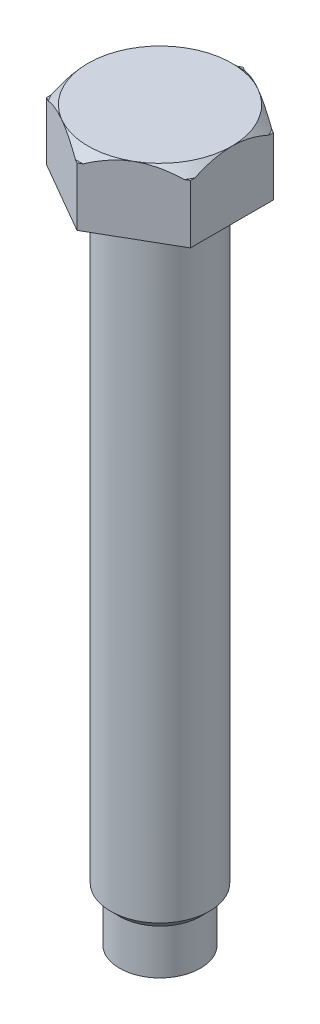
from build123d import *

# Parameters (mm, degrees)
SKETCH1_R      = 5.5
EXTRUDE1_DEPTH = 73
EXTRUDE2_DEPTH = 8
SKETCH3_R      = 14.116748978
SKETCH3_R_2    = 7
EXTRUDE3_DEPTH = 0.5
SKETCH4_R      = 19.693652211
SKETCH4_R_2    = 4.5
EXTRUDE4_DEPTH = 5
CHAMFER1_SIZE  = 1
SKETCH5_R      = 25.58893004
SKETCH5_R_2    = 8
EXTRUDE5_DEPTH = 1
CHAMFER2_SIZE  = 1


# Some blends are built 0.0001 mm under size
with BuildPart() as part:
    # Sketch1 → Extrude1 (new body)
    with BuildSketch(Plane(origin=(0, 0, 0), x_dir=(1, 0, 0), z_dir=(0, 1, 0))):
        with Locations(Location((0, 0, 0), (0, 0, 270))):
            Circle(SKETCH1_R)
    extrude(amount=EXTRUDE1_DEPTH)

    # Sketch2 → Extrude2 (add)
    with BuildSketch(Plane(origin=(0, 73, 0), x_dir=(1, 0, 0), z_dir=(0, 1, 0))):
        Polygon((8, -4.618802154), (8, 4.618802154), (0, 9.237604307), (-8, 4.618802154), (-8, -4.618802154), (0, -9.237604307), align=None)
    extrude(amount=EXTRUDE2_DEPTH)

    # Sketch3 → Extrude3 (cut)
    with BuildSketch(Plane.XZ.offset(-73)):
        Circle(SKETCH3_R)
        with Locations(Location((0, 0, 0), (0, 0, 270))):
            Circle(SKETCH3_R_2, mode=Mode.SUBTRACT)
    extrude(amount=-EXTRUDE3_DEPTH, mode=Mode.SUBTRACT)

    # Sketch4 → Extrude4 (cut)
    with BuildSketch(Plane.XZ):
        Circle(SKETCH4_R)
        with Locations(Location((0, 0, 0), (0, 0, 270))):
            Circle(SKETCH4_R_2, mode=Mode.SUBTRACT)
    extrude(amount=-EXTRUDE4_DEPTH, mode=Mode.SUBTRACT)

    # Chamfer1
    chamfer1_edges = [part.edges().sort_by_distance(p)[0] for p in [
        (0, 5, -5.5),
    ]]
    chamfer(chamfer1_edges, length=CHAMFER1_SIZE - 0.0001)  # a hair under: the kernel refuses the full size

    # Sketch5 → Extrude5 (cut)
    with BuildSketch(Plane(origin=(0, 81, 0), x_dir=(1, 0, 0), z_dir=(0, 1, 0))):
        Circle(SKETCH5_R)
        with Locations(Location((0, 0, 0), (0, 0, 270))):
            Circle(SKETCH5_R_2, mode=Mode.SUBTRACT)
    extrude(amount=-EXTRUDE5_DEPTH, mode=Mode.SUBTRACT)

    # Chamfer2
    # the kernel refuses this chamfer: 1 mm, written as the material it adds along each edge
    with BuildSketch(Plane(origin=(0, 80, 0), x_dir=(0.5000000000000043, 0, -0.8660254037844362), z_dir=(0.8660254037844362, 0, 0.5000000000000043))) as chamfer2_piece_1_section:
        Polygon((8, CHAMFER2_SIZE), (8 + CHAMFER2_SIZE, 0), (8, 0), align=None)
    chamfer2_piece_1 = revolve(axis=Axis((0, 80, 0), (0, 1, 0)), revolution_arc=60, mode=Mode.PRIVATE)
    chamfer2_piece_1 = split(chamfer2_piece_1, bisect_by=Plane(origin=(-0.488712857, 80.376891688, -8.955445807), z_dir=(0.49999999999999606, 0, 0.8660254037844412)), keep=Keep.TOP, mode=Mode.PRIVATE)
    chamfer2_piece_1 = split(chamfer2_piece_1, bisect_by=Plane(origin=(0.488712857, 80.376891688, -8.955445807), z_dir=(-0.500000000000004, 0, 0.8660254037844364)), keep=Keep.TOP, mode=Mode.PRIVATE)
    add(chamfer2_piece_1)
    with BuildSketch(Plane(origin=(0, 80, 0), x_dir=(-0.4999999999999957, 0, -0.8660254037844412), z_dir=(0.8660254037844412, 0, -0.4999999999999957))) as chamfer2_piece_2_section:
        Polygon((8, CHAMFER2_SIZE), (8 + CHAMFER2_SIZE, 0), (8, 0), align=None)
    chamfer2_piece_2 = revolve(axis=Axis((0, 80, 0), (0, 1, 0)), revolution_arc=60, mode=Mode.PRIVATE)
    chamfer2_piece_2 = split(chamfer2_piece_2, bisect_by=Plane(origin=(-8, 80.376891688, -4.054485154), z_dir=(1, 0, 0)), keep=Keep.TOP, mode=Mode.PRIVATE)
    chamfer2_piece_2 = split(chamfer2_piece_2, bisect_by=Plane(origin=(-7.511287143, 80.376891688, -4.900960653), z_dir=(0.49999999999999606, 0, 0.8660254037844412)), keep=Keep.TOP, mode=Mode.PRIVATE)
    add(chamfer2_piece_2)
    with BuildSketch(Plane(origin=(0, 80, 0), x_dir=(-1, 0, 0), z_dir=(0, 0, -1))) as chamfer2_piece_3_section:
        Polygon((8, CHAMFER2_SIZE), (8 + CHAMFER2_SIZE, 0), (8, 0), align=None)
    chamfer2_piece_3 = revolve(axis=Axis((0, 80, 0), (0, 1, 0)), revolution_arc=60, mode=Mode.PRIVATE)
    chamfer2_piece_3 = split(chamfer2_piece_3, bisect_by=Plane(origin=(-7.511287143, 80.376891688, 4.900960653), z_dir=(0.5000000000000039, 0, -0.8660254037844365)), keep=Keep.TOP, mode=Mode.PRIVATE)
    chamfer2_piece_3 = split(chamfer2_piece_3, bisect_by=Plane(origin=(-8, 80.376891688, 4.054485154), z_dir=(1, 0, 0)), keep=Keep.TOP, mode=Mode.PRIVATE)
    add(chamfer2_piece_3)
    with BuildSketch(Plane(origin=(0, 80, 0), x_dir=(1, 0, 0), z_dir=(0, 0, 1))) as chamfer2_piece_4_section:
        Polygon((8, CHAMFER2_SIZE), (8 + CHAMFER2_SIZE, 0), (8, 0), align=None)
    chamfer2_piece_4 = revolve(axis=Axis((0, 80, 0), (0, 1, 0)), revolution_arc=60, mode=Mode.PRIVATE)
    chamfer2_piece_4 = split(chamfer2_piece_4, bisect_by=Plane(origin=(8, 80.376891688, -4.054485154), z_dir=(-1, 0, 0)), keep=Keep.TOP, mode=Mode.PRIVATE)
    chamfer2_piece_4 = split(chamfer2_piece_4, bisect_by=Plane(origin=(7.511287143, 80.376891688, -4.900960653), z_dir=(-0.500000000000004, 0, 0.8660254037844364)), keep=Keep.TOP, mode=Mode.PRIVATE)
    add(chamfer2_piece_4)
    with BuildSketch(Plane(origin=(0, 80, 0), x_dir=(-0.5000000000000046, 0, 0.8660254037844362), z_dir=(-0.8660254037844362, 0, -0.5000000000000046))) as chamfer2_piece_5_section:
        Polygon((8, CHAMFER2_SIZE), (8 + CHAMFER2_SIZE, 0), (8, 0), align=None)
    chamfer2_piece_5 = revolve(axis=Axis((0, 80, 0), (0, 1, 0)), revolution_arc=30, mode=Mode.PRIVATE)
    chamfer2_piece_5 = split(chamfer2_piece_5, bisect_by=Plane(origin=(-1.40811023, 80.376891688, 8.424631487), z_dir=(0.5000000000000039, 0, -0.8660254037844365)), keep=Keep.TOP, mode=Mode.PRIVATE)
    add(chamfer2_piece_5)
    with BuildSketch(Plane(origin=(0, 80, 0), x_dir=(0.4999999999999962, 0, 0.8660254037844408), z_dir=(-0.8660254037844408, 0, 0.4999999999999962))) as chamfer2_piece_6_section:
        Polygon((8 + CHAMFER2_SIZE, 0), (8, CHAMFER2_SIZE), (8, 0), align=None)
    chamfer2_piece_6 = revolve(axis=Axis((0, 80, 0), (0, 1, 0)), revolution_arc=60, mode=Mode.PRIVATE)
    chamfer2_piece_6 = split(chamfer2_piece_6, bisect_by=Plane(origin=(8, 80.376891688, 4.054485154), z_dir=(-1, 0, 0)), keep=Keep.TOP, mode=Mode.PRIVATE)
    chamfer2_piece_6 = split(chamfer2_piece_6, bisect_by=Plane(origin=(7.511287143, 80.376891688, 4.900960653), z_dir=(-0.4999999999999963, 0, -0.866025403784441)), keep=Keep.TOP, mode=Mode.PRIVATE)
    add(chamfer2_piece_6)
    with BuildSketch(Plane(origin=(0, 80, 0), x_dir=(0, 0, 1), z_dir=(-1, 0, 0))) as chamfer2_piece_7_section:
        Polygon((8, CHAMFER2_SIZE), (8 + CHAMFER2_SIZE, 0), (8, 0), align=None)
    chamfer2_piece_7 = revolve(axis=Axis((0, 80, 0), (0, 1, 0)), revolution_arc=30, mode=Mode.PRIVATE)
    chamfer2_piece_7 = split(chamfer2_piece_7, bisect_by=Plane(origin=(1.40811023, 80.376891688, 8.424631487), z_dir=(-0.4999999999999963, 0, -0.866025403784441)), keep=Keep.TOP, mode=Mode.PRIVATE)
    add(chamfer2_piece_7)


solid = part.part
